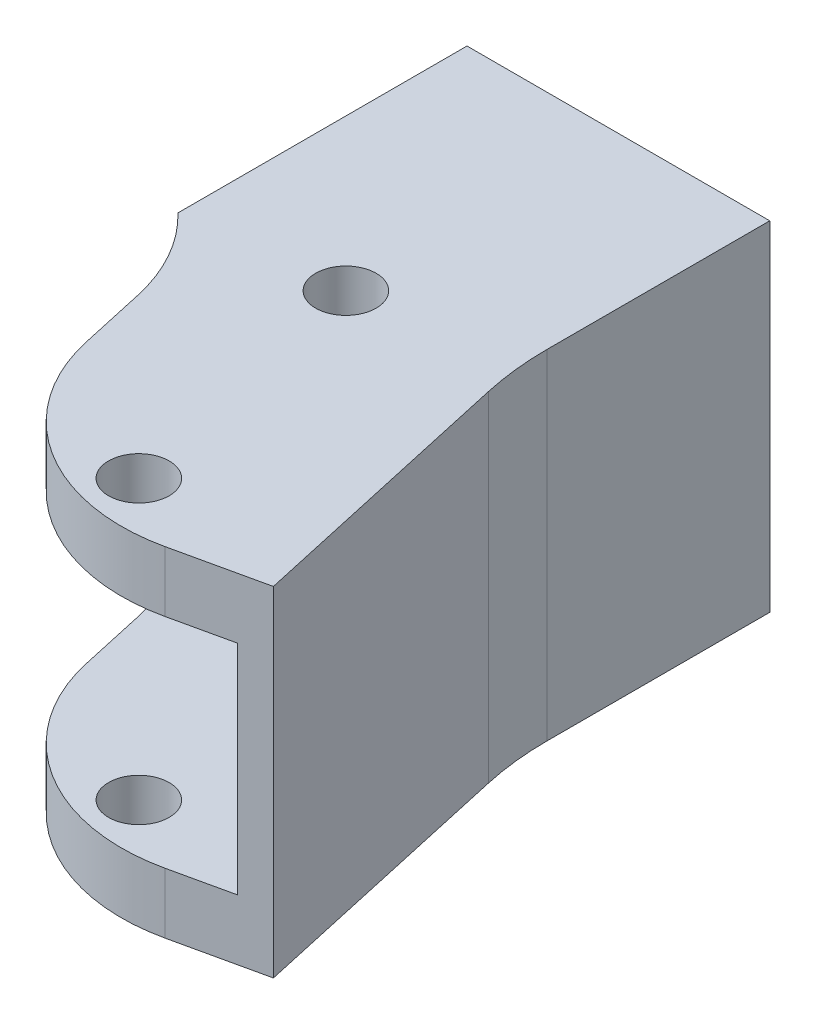
from build123d import *

# Parameters (mm, degrees)
SKETCH_1_W          = 40
SKETCH_1_H          = 36
SKETCH_1_R          = 1.6
SKETCH_1_R_2        = 3.25
EXTRUDE_1_DEPTH     = 5
SKETCH_2_R          = 13
CUT_EXTRUDE_1_DEPTH = 2.5
SKETCH_7_R          = 5
EXTRUDE_2_DEPTH     = 10
SKETCH_10_R         = 5
EXTRUDE_4_DEPTH     = 2
EXTRUDE_3_REACH     = 123.4
FILLET_1_R          = 30
FILLET_2_R          = 50
FILLET_6_R          = 5


with BuildPart() as part:
    # ｽｹｯﾁ1 → ﾎﾞｽ - 押し出し1 (new body)
    with BuildSketch(Plane.XY):
        Rectangle(SKETCH_1_W, SKETCH_1_H)
        with Locations((0, 8.5)):
            Circle(SKETCH_1_R, mode=Mode.SUBTRACT)
        with Locations((8.5, 0)):
            Circle(SKETCH_1_R, mode=Mode.SUBTRACT)
        with Locations((0, -8.5)):
            Circle(SKETCH_1_R, mode=Mode.SUBTRACT)
        with Locations((-8.5, 0)):
            Circle(SKETCH_1_R, mode=Mode.SUBTRACT)
        Circle(SKETCH_1_R_2, mode=Mode.SUBTRACT)
    extrude(amount=EXTRUDE_1_DEPTH)

    # ｽｹｯﾁ2 → ｶｯﾄ - 押し出し1 (cut)
    with BuildSketch(Plane.XY.offset(5)):
        Circle(SKETCH_2_R)
    extrude(amount=-CUT_EXTRUDE_1_DEPTH, mode=Mode.SUBTRACT)

    # ｽｹｯﾁ7 → ﾎﾞｽ - 押し出し2 (add)
    with BuildSketch(Plane.XZ.offset(18)):
        Polygon((-20, 0), (-20, 47.190356234), (-7.621741376, 103.02507267), (31.430098909, 94.367488113), (20, 42.809643766), (20, 0), align=None)
        with Locations((0, 45)):
            Circle(SKETCH_7_R, mode=Mode.SUBTRACT)
        with Locations((9.739782627, 88.93332032)):
            Circle(SKETCH_7_R, mode=Mode.SUBTRACT)
    extrude_2 = extrude(amount=EXTRUDE_2_DEPTH)

    # ｽｹｯﾁ10 → ﾎﾞｽ - 押し出し4 (add)
    with BuildSketch(Plane(origin=(0, -18, 0), x_dir=(1, 0, 0), z_dir=(0, 1, 0))):
        with Locations(Location((0, -45, 0), (0, 0, 180))):
            Circle(SKETCH_10_R)
    extrude_4 = extrude(amount=-EXTRUDE_4_DEPTH)

    # ﾐﾗｰ3: ﾎﾞｽ - 押し出し2, ﾎﾞｽ - 押し出し4 across plane
    add(extrude_2.mirror(Plane.ZX))
    add(extrude_4.mirror(Plane.ZX))

    # ﾎﾞｽ - 押し出し3: up to this face of the body (flat: up to its plane)
    extrude_3_end = Plane(part.part.faces().sort_by_distance((-18.848513106, 28, 23.595178117))[0])
    # ｽｹｯﾁ8 → ﾎﾞｽ - 押し出し3 (add, up to the picked face)
    with BuildSketch(Plane.XZ.offset(28), mode=Mode.PRIVATE) as extrude_3_sk1:
        Polygon((-20, 47.190356234), (-20, 0), (-25, 0), (-25, 47.737945292), align=None)
    extrude_3_tool1 = split(extrude(extrude_3_sk1.sketch, amount=-EXTRUDE_3_REACH, mode=Mode.PRIVATE), bisect_by=extrude_3_end, keep=Keep.BOTH, mode=Mode.PRIVATE)
    # ｽｹｯﾁ8 → ﾎﾞｽ - 押し出し3 (add, up to the picked face)
    with BuildSketch(Plane.XZ.offset(28), mode=Mode.PRIVATE) as extrude_3_sk2:
        Polygon((20, 42.809643766), (31.430098909, 94.367488113), (36.311578945, 93.285290043), (25, 42.262054708), (25, 0), (20, 0), align=None)
    extrude_3_tool2 = split(extrude(extrude_3_sk2.sketch, amount=-EXTRUDE_3_REACH, mode=Mode.PRIVATE), bisect_by=extrude_3_end, keep=Keep.BOTH, mode=Mode.PRIVATE)
    add(extrude_3_tool1.solids().sort_by(Axis((-22.504807, -28, 23.732339), (0, 1, 0)))[0])
    add(extrude_3_tool2.solids().sort_by(Axis((25.636945, -28, 47.192298), (0, 1, 0)))[0])

    # ﾌｨﾚｯﾄ1
    # the kernel refuses this fillet: 30 mm, written as the material it adds along each edge
    with BuildSketch(Plane(origin=(-20, 22.088837233, 47.190356234), x_dir=(0.2164396139380964, 0, 0.9762960071199349), z_dir=(0, -1, 0))) as fillet_1_piece_1_section:
        with BuildLine():
            CenterArc((16.035534893, 30), FILLET_1_R, 236.442690238, 33.557309762)
            Line((-0.547589058, 5), (0, 0))
            Line((0, 0), (16.035534893, 0))
        make_face()
    fillet_1_piece_1 = extrude(amount=90.177674467, mode=Mode.PRIVATE)
    fillet_1_piece_1 = split(fillet_1_piece_1, bisect_by=Plane(origin=(-20, 18, 47.190356234), z_dir=(0, 1, 0)), keep=Keep.TOP, mode=Mode.PRIVATE)
    add(fillet_1_piece_1)
    with BuildSketch(Plane(origin=(-20, -18, 47.190356234), x_dir=(0.2164396139380964, 0, 0.9762960071199349), z_dir=(0, -1, 0))) as fillet_1_piece_2:
        with BuildLine():
            CenterArc((16.035534893, 30), FILLET_1_R, 236.442690238, 33.557309762)
            Line((-0.547589058, 5), (0, 0))
            Line((0, 0), (16.035534893, 0))
        make_face()
    extrude(amount=10)
    with BuildSketch(Plane(origin=(-20, -22.088837233, 47.190356234), x_dir=(-0.9940563382222736, 0, 0.10886687485238501), z_dir=(0, 1, 0))) as fillet_1_piece_3_section:
        with BuildLine():
            CenterArc((28.075951576, 19.206231343), FILLET_1_R, 186.25, 33.557309762)
            Line((-1.74573857, 15.940225098), (0, 0))
            Line((0, 0), (5.029896001, 0))
        make_face()
    fillet_1_piece_3 = extrude(amount=90.177674467, mode=Mode.PRIVATE)
    fillet_1_piece_3 = split(fillet_1_piece_3, bisect_by=Plane(origin=(-20, -18, 47.190356234), z_dir=(0, -1, 0)), keep=Keep.TOP, mode=Mode.PRIVATE)
    add(fillet_1_piece_3)
    with BuildSketch(Plane(origin=(-20, 18, 47.190356234), x_dir=(-0.9940563382222736, 0, 0.10886687485238501), z_dir=(0, 1, 0))) as fillet_1_piece_4:
        with BuildLine():
            CenterArc((28.075951576, 19.206231343), FILLET_1_R, 186.25, 33.557309762)
            Line((-1.74573857, 15.940225098), (0, 0))
            Line((0, 0), (5.029896001, 0))
        make_face()
    extrude(amount=10)
    # the kernel refuses this fillet: 30 mm, written as the material it takes off along each edge
    with BuildSketch(Plane(origin=(-7.621741376, 57, 103.02507267), x_dir=(0.9762960071199346, 0, -0.21643961393809735), z_dir=(0, -1, 0))) as fillet_1_2_piece_1:
        with BuildLine():
            CenterArc((FILLET_1_R, -FILLET_1_R), FILLET_1_R, 90, 90)
            Line((0, -FILLET_1_R), (0, 0))
            Line((0, 0), (FILLET_1_R, 0))
        make_face()
    extrude(amount=160, mode=Mode.SUBTRACT)
    with BuildSketch(Plane(origin=(-7.621741376, -57, 103.02507267), x_dir=(0.9762960071199348, 0, -0.21643961393809644), z_dir=(0, 1, 0))) as fillet_1_2_piece_2:
        with BuildLine():
            CenterArc((FILLET_1_R, FILLET_1_R), FILLET_1_R, 180, 90)
            Line((0, FILLET_1_R), (0, 0))
            Line((0, 0), (FILLET_1_R, 0))
        make_face()
    extrude(amount=160, mode=Mode.SUBTRACT)

    # ﾌｨﾚｯﾄ2
    fillet_2_edges = [part.edges().sort_by_distance(p)[0] for p in [
        (25, 0, 42.262054708),
    ]]
    fillet(fillet_2_edges, radius=FILLET_2_R)

    # ﾌｨﾚｯﾄ6
    # the kernel refuses this fillet: 5 mm, written as the material it adds along each edge
    with BuildSketch(Plane(origin=(-7.574295772, 18, 45.829520298), x_dir=(0.10886687485234858, 0, 0.9940563382222776), z_dir=(-0.9940563382222776, 0, 0.1088668748523486))) as fillet_6_piece_1_section:
        with BuildLine():
            CenterArc((FILLET_6_R, -FILLET_6_R), FILLET_6_R, 90, 90)
            Line((0, -FILLET_6_R), (0, 0))
            Line((0, 0), (FILLET_6_R, 0))
        make_face()
    fillet_6_piece_1 = extrude(amount=30.029896001, mode=Mode.PRIVATE)
    fillet_6_piece_1 = split(fillet_6_piece_1, bisect_by=Plane(origin=(-25, 18, 45.829520298), z_dir=(1, 0, 0)), keep=Keep.TOP, mode=Mode.PRIVATE)
    fillet_6_piece_1 = fillet_6_piece_1 - Plane(origin=(-45.818155232, 18, 69.33897334), x_dir=(-0.9940563382223121, 0, 0.10886687485203418), z_dir=(0, -1, 0)) * Cylinder(30, 81, mode=Mode.PRIVATE)
    fillet_6_piece_1 = split(fillet_6_piece_1, bisect_by=Plane(origin=(-20, 18, 45.829520298), z_dir=(-1, 0, 0)), keep=Keep.TOP, mode=Mode.PRIVATE)
    add(fillet_6_piece_1)
    with BuildSketch(Plane(origin=(-37.425704228, -18, 49.098781228), x_dir=(0.10886687485234857, 0, 0.9940563382222776), z_dir=(0.9940563382222777, 0, -0.10886687485234858))) as fillet_6_piece_2_section:
        with BuildLine():
            CenterArc((FILLET_6_R, -FILLET_6_R), FILLET_6_R, 90, 90)
            Line((0, -FILLET_6_R), (0, 0))
            Line((0, 0), (FILLET_6_R, 0))
        make_face()
    fillet_6_piece_2 = extrude(amount=30.029896001, mode=Mode.PRIVATE)
    fillet_6_piece_2 = split(fillet_6_piece_2, bisect_by=Plane(origin=(-25, -18, 49.098781228), z_dir=(1, 0, 0)), keep=Keep.TOP, mode=Mode.PRIVATE)
    fillet_6_piece_2 = split(fillet_6_piece_2, bisect_by=Plane(origin=(-20, -18, 49.098781228), z_dir=(-1, 0, 0)), keep=Keep.TOP, mode=Mode.PRIVATE)
    fillet_6_piece_2 = fillet_6_piece_2 - Plane(origin=(-45.818155232, -18, 69.33897334), x_dir=(0.21643961393799077, 0, 0.9762960071199583), z_dir=(0, 1, 0)) * Cylinder(30, 81, mode=Mode.PRIVATE)
    add(fillet_6_piece_2)


solid = part.part
